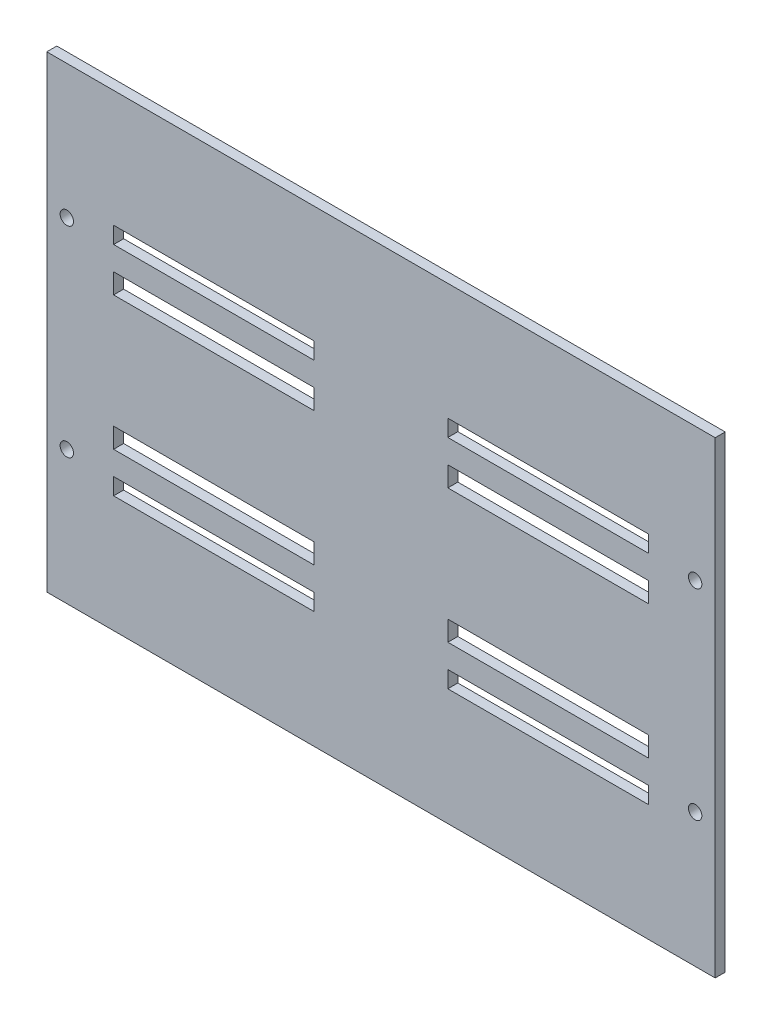
from build123d import *

# Parameters (mm, degrees)
SKETCH_2_W               = 200
SKETCH_2_H               = 140
EXTRUDE_1_DEPTH          = 3
SKETCH_3_R               = 2
CUT_EXTRUDE_1_DEPTH      = 3
SKETCH_4_W               = 60
SKETCH_4_H               = 6
CUT_EXTRUDE_2_DEPTH      = 10
SKETCH_5_W               = 60
SKETCH_5_H               = 5
CUT_EXTRUDE_3_DEPTH      = 6
MIRROR_2_COPY_1_SKETCH_W = 60
MIRROR_2_COPY_1_SKETCH_H = 5
MIRROR_2_COPY_1_DEPTH    = 6


with BuildPart() as part:
    # 草图2 → 凸台-拉伸1 (new body)
    with BuildSketch(Plane.XY):
        Rectangle(SKETCH_2_W, SKETCH_2_H)
    extrude(amount=EXTRUDE_1_DEPTH)

    # 草图3 → 切除-拉伸1 (cut)
    with BuildSketch(Plane.XY.offset(3)):
        with Locations((94, 30)):
            Circle(SKETCH_3_R)
        with Locations((94, -30)):
            Circle(SKETCH_3_R)
    cut_extrude_1 = extrude(amount=-CUT_EXTRUDE_1_DEPTH, mode=Mode.SUBTRACT)

    # 草图4 → 切除-拉伸2 (cut)
    with BuildSketch(Plane.XY.offset(3)):
        with Locations((50, 20)):
            Rectangle(SKETCH_4_W, SKETCH_4_H)
        with Locations((50, -20)):
            Rectangle(SKETCH_4_W, SKETCH_4_H)
    cut_extrude_2 = extrude(amount=-CUT_EXTRUDE_2_DEPTH, mode=Mode.SUBTRACT)

    # 草图5 → 切除-拉伸3 (cut)
    with BuildSketch(Plane(origin=(0, 0, 0), x_dir=(-1, 0, 0), z_dir=(0, 0, -1))):
        with Locations((-50, 32.56110703)):
            Rectangle(SKETCH_5_W, SKETCH_5_H)
    cut_extrude_3 = extrude(amount=-CUT_EXTRUDE_3_DEPTH, mode=Mode.SUBTRACT)

    # 镜向1: 切除-拉伸3 across plane
    add(cut_extrude_3.mirror(Plane.ZX), mode=Mode.SUBTRACT)

    # 镜向2: 切除-拉伸1, 切除-拉伸2, 切除-拉伸3 across plane
    add(cut_extrude_1.mirror(Plane.ZY), mode=Mode.SUBTRACT)
    add(cut_extrude_2.mirror(Plane.ZY), mode=Mode.SUBTRACT)
    add(cut_extrude_3.mirror(Plane.ZY), mode=Mode.SUBTRACT)

    # 镜向2 copy 1 sketch → 镜向2 copy 1 (cut)
    with BuildSketch(Plane(origin=(0, 0, 0), x_dir=(1, 0, 0), z_dir=(0, 0, -1))):
        with Locations((-50, 32.56110703)):
            Rectangle(MIRROR_2_COPY_1_SKETCH_W, MIRROR_2_COPY_1_SKETCH_H)
    extrude(amount=-MIRROR_2_COPY_1_DEPTH, mode=Mode.SUBTRACT)


solid = part.part
